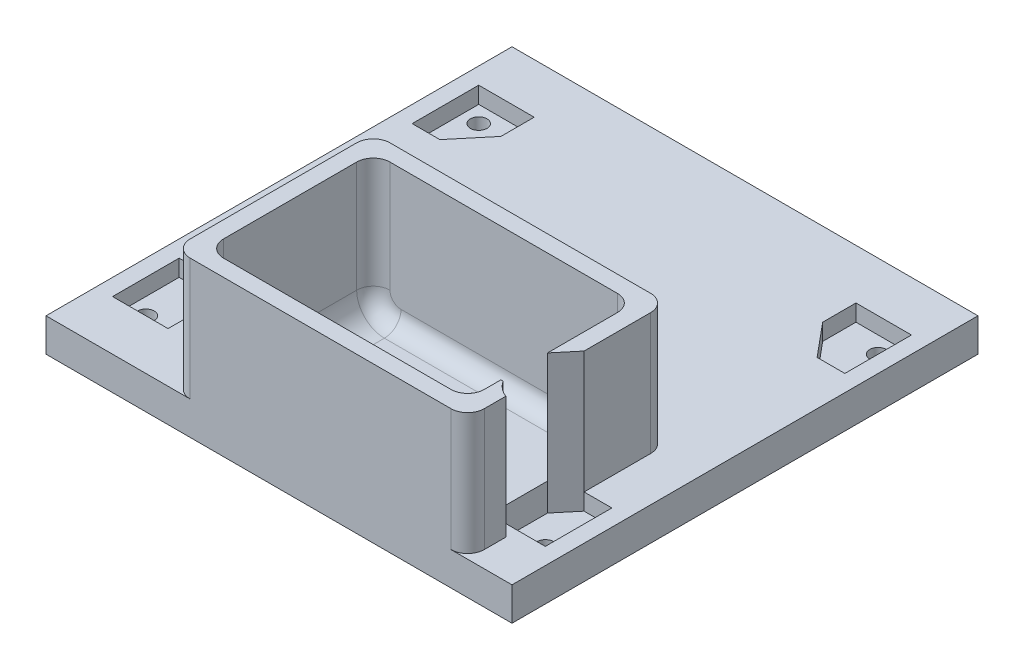
from build123d import *

# Parameters (mm, degrees)
SKETCH1_W               = 84
SKETCH1_H               = 84
BOSS_EXTRUDE1_DEPTH     = 6
SKETCH2_R               = 1.5
CUT_EXTRUDE1_DEPTH      = 119.94536561
SKETCH4_R               = 1.5
CUT_EXTRUDE4_DEPTH      = 3
MIRROR3_COPY_1_SKETCH_R = 1.5
MIRROR3_COPY_1_DEPTH    = 3
SKETCH5_W               = 53
SKETCH5_H               = 36
BOSS_EXTRUDE2_DEPTH     = 22
SKETCH6_W               = 47
SKETCH6_H               = 30
CUT_EXTRUDE5_DEPTH      = 25
FILLET1_R               = 3
FILLET2_R               = 5
BOSS_EXTRUDE3_START     = -17.4
BOSS_EXTRUDE3_DEPTH     = 8.4
CUT_EXTRUDE14_START     = -22
CUT_EXTRUDE14_DEPTH     = 22
CUT_EXTRUDE15_DEPTH     = 122.396046085


# Read off the part's stored shape, not the designer's step: Boss-Extrude3
with BuildPart() as part:
    # Sketch1 → Boss-Extrude1 (new body)
    with BuildSketch(Plane(origin=(0, 0, 0), x_dir=(1, 0, 0), z_dir=(0, 1, 0))):
        with Locations((42, 42)):
            Rectangle(SKETCH1_W, SKETCH1_H)
    extrude(amount=BOSS_EXTRUDE1_DEPTH)

    # Sketch2 → Cut-Extrude1 (cut, through all)
    with BuildSketch(Plane(origin=(0, 6, 0), x_dir=(1, 0, 0), z_dir=(0, 1, 0))):
        with Locations(Location((6, 72, 0), (0, 0, 270))):
            Circle(SKETCH2_R)
        with Locations(Location((6, 12, 0), (0, 0, 270))):
            Circle(SKETCH2_R)
        with Locations(Location((78, 12, 0), (0, 0, 270))):
            Circle(SKETCH2_R)
        with Locations(Location((78, 72, 0), (0, 0, 270))):
            Circle(SKETCH2_R)
    extrude(amount=-CUT_EXTRUDE1_DEPTH, mode=Mode.SUBTRACT)

    # Sketch4 → Cut-Extrude4 (cut)
    with BuildSketch(Plane(origin=(0, 6, 0), x_dir=(1, 0, 0), z_dir=(0, 1, 0))):
        Polygon((13, 15), (13, 9), (3, 9), (3, 21), (8, 21), align=None)
        with Locations(Location((6, 12, 0), (0, 0, 270))):
            Circle(SKETCH4_R, mode=Mode.SUBTRACT)
    cut_extrude4 = extrude(amount=-CUT_EXTRUDE4_DEPTH, mode=Mode.SUBTRACT)

    # Mirror2: Cut-Extrude4 across plane
    add(cut_extrude4.mirror(Plane.XY.offset(-42)), mode=Mode.SUBTRACT)

    # Mirror3: Cut-Extrude4 across plane
    add(cut_extrude4.mirror(Plane.ZY.offset(-42)), mode=Mode.SUBTRACT)

    # Mirror3 copy 1 sketch → Mirror3 copy 1 (cut)
    with BuildSketch(Plane(origin=(84, 6, -84), x_dir=(-1, 0, 0), z_dir=(0, 1, 0))):
        Polygon((13, 15), (13, 9), (3, 9), (3, 21), (8, 21), align=None)
        with Locations(Location((6, 12, 0), (0, 0, 270))):
            Circle(MIRROR3_COPY_1_SKETCH_R, mode=Mode.SUBTRACT)
    extrude(amount=-MIRROR3_COPY_1_DEPTH, mode=Mode.SUBTRACT)

    # Sketch5 → Boss-Extrude2 (add)
    with BuildSketch(Plane(origin=(0, 6, 0), x_dir=(1, 0, 0), z_dir=(0, 1, 0))):
        with Locations((49.5, 18)):
            Rectangle(SKETCH5_W, SKETCH5_H)
    extrude(amount=BOSS_EXTRUDE2_DEPTH)

    # Sketch6 → Cut-Extrude5 (cut)
    with BuildSketch(Plane(origin=(0, 28, 0), x_dir=(1, 0, 0), z_dir=(0, 1, 0))):
        with Locations((49.5, 18)):
            Rectangle(SKETCH6_W, SKETCH6_H)
    extrude(amount=-CUT_EXTRUDE5_DEPTH, mode=Mode.SUBTRACT)

    # Fillet1
    fillet1_edges = [part.edges().sort_by_distance(p)[0] for p in [
        (76, 17, -36),
        (23, 17, -36),
        (23, 17, 0),
        (76, 17, 0),
        (73, 15.5, -33),
        (49.5, 3, -3),
        (73, 15.5, -3),
        (26, 15.5, -3),
        (49.5, 3, -33),
        (26, 15.5, -33),
    ]]
    fillet(fillet1_edges, radius=FILLET1_R)

    # Fillet2
    # the kernel refuses this fillet: 5 mm, written as the material it adds along each edge
    with BuildSketch(Plane(origin=(31, 8, -3), x_dir=(-1, 0, 0), z_dir=(0, 1, 0))) as fillet2_piece_1:
        with BuildLine():
            CenterArc((2, -3), 3, 0, 90)
            Line((5, -3), (5, 0))
            Line((5, 0), (2, 0))
        make_face()
    revolve(axis=Axis((31, 8, -3), (0, 0, 1)), revolution_arc=90)
    with BuildSketch(Plane(origin=(31, 8, -33), x_dir=(0, -1, 0), z_dir=(1, 0, 0))) as fillet2_piece_2:
        with BuildLine():
            CenterArc((2, -3), 3, 0, 90)
            Line((5, -3), (5, 0))
            Line((5, 0), (2, 0))
        make_face()
    revolve(axis=Axis((31, 8, -33), (0, 0, -1)), revolution_arc=90)
    with BuildSketch(Plane(origin=(68, 8, -3), x_dir=(0, -1, 0), z_dir=(-1, 0, 0))) as fillet2_piece_3:
        with BuildLine():
            CenterArc((2, -3), 3, 0, 90)
            Line((5, -3), (5, 0))
            Line((5, 0), (2, 0))
        make_face()
    revolve(axis=Axis((68, 8, -3), (0, 0, 1)), revolution_arc=90)
    with BuildSketch(Plane(origin=(73, 3, -4.9), x_dir=(-1, 0, 0), z_dir=(0, 0, -1))) as fillet2_piece_4_section:
        with BuildLine():
            CenterArc((FILLET2_R, FILLET2_R), FILLET2_R, 180, 90)
            Line((0, FILLET2_R), (0, 0))
            Line((0, 0), (FILLET2_R, 0))
        make_face()
    fillet2_piece_4 = extrude(amount=37.6, mode=Mode.PRIVATE)
    fillet2_piece_4 = split(fillet2_piece_4, bisect_by=Plane(origin=(71.840443932, 4.051726495, -9), z_dir=(0, 0, 1)), keep=Keep.TOP, mode=Mode.PRIVATE)
    add(fillet2_piece_4)
    with BuildSketch(Plane(origin=(73, 3, -4.9), x_dir=(-1, 0, 0), z_dir=(0, 0, -1))) as fillet2_piece_5_section:
        with BuildLine():
            CenterArc((FILLET2_R, FILLET2_R), FILLET2_R, 180, 90)
            Line((0, FILLET2_R), (0, 0))
            Line((0, 0), (FILLET2_R, 0))
        make_face()
    fillet2_piece_5 = extrude(amount=37.6, mode=Mode.PRIVATE)
    fillet2_piece_5 = split(fillet2_piece_5, bisect_by=Plane(origin=(72.877053979, 6.49875804, -36), z_dir=(0, 0, 1)), keep=Keep.TOP, mode=Mode.PRIVATE)
    fillet2_piece_5 = split(fillet2_piece_5, bisect_by=Plane(origin=(72.877053979, 6, -13.126232387), z_dir=(0, 1, 0)), keep=Keep.TOP, mode=Mode.PRIVATE)
    add(fillet2_piece_5)
    with BuildSketch(Plane(origin=(73, 3, -4.9), x_dir=(-1, 0, 0), z_dir=(0, 0, -1))) as fillet2_piece_6_section:
        with BuildLine():
            CenterArc((FILLET2_R, FILLET2_R), FILLET2_R, 180, 90)
            Line((0, FILLET2_R), (0, 0))
            Line((0, 0), (FILLET2_R, 0))
        make_face()
    fillet2_piece_6 = extrude(amount=37.6, mode=Mode.PRIVATE)
    fillet2_piece_6 = split(fillet2_piece_6, bisect_by=Plane(origin=(74.593810092, 3.935909556, -19.312572111), z_dir=(-0.7682212795973755, 0, -0.6401843996644804)), keep=Keep.TOP, mode=Mode.PRIVATE)
    fillet2_piece_6 = split(fillet2_piece_6, bisect_by=Plane(origin=(71.754876355, 6, -21.678350226), z_dir=(0, -1, 0)), keep=Keep.TOP, mode=Mode.PRIVATE)
    add(fillet2_piece_6)
    with BuildSketch(Plane(origin=(73, 3, -3), x_dir=(-1, 0, 0), z_dir=(0, 0, -1))) as fillet2_piece_7:
        with BuildLine():
            CenterArc((FILLET2_R, FILLET2_R), FILLET2_R, 180, 90)
            Line((0, FILLET2_R), (0, 0))
            Line((0, 0), (FILLET2_R, 0))
        make_face()
    extrude(amount=6)
    with BuildSketch(Plane(origin=(73, 3, -3), x_dir=(-1, 0, 0), z_dir=(0, 0, -1))) as fillet2_piece_8_section:
        with BuildLine():
            CenterArc((FILLET2_R, FILLET2_R), FILLET2_R, 180, 90)
            Line((0, FILLET2_R), (0, 0))
            Line((0, 0), (FILLET2_R, 0))
        make_face()
    fillet2_piece_8 = extrude(amount=18.5, mode=Mode.PRIVATE)
    fillet2_piece_8 = split(fillet2_piece_8, bisect_by=Plane(origin=(72.877053979, 6, -13.126232386), z_dir=(0, 1, 0)), keep=Keep.TOP, mode=Mode.PRIVATE)
    add(fillet2_piece_8)
    with BuildSketch(Plane(origin=(73, 3, -3), x_dir=(-1, 0, 0), z_dir=(0, 0, -1))) as fillet2_piece_9_section:
        with BuildLine():
            CenterArc((FILLET2_R, FILLET2_R), FILLET2_R, 180, 90)
            Line((0, FILLET2_R), (0, 0))
            Line((0, 0), (FILLET2_R, 0))
        make_face()
    fillet2_piece_9 = extrude(amount=18.5, mode=Mode.PRIVATE)
    fillet2_piece_9 = split(fillet2_piece_9, bisect_by=Plane(origin=(73.049643728, 3.899661729, -17.459572473), z_dir=(-0.7682212795973755, 0, -0.6401843996644804)), keep=Keep.TOP, mode=Mode.PRIVATE)
    add(fillet2_piece_9)
    with BuildSketch(Plane(origin=(26, 3, -33), x_dir=(1, 0, 0), z_dir=(0, 0, 1))) as fillet2_piece_10:
        with BuildLine():
            CenterArc((FILLET2_R, FILLET2_R), FILLET2_R, 180, 90)
            Line((0, FILLET2_R), (0, 0))
            Line((0, 0), (FILLET2_R, 0))
        make_face()
    extrude(amount=30)

    # Boss-Extrude3 outline → Boss-Extrude3 (add)
    with BuildSketch(Plane.XY.offset(BOSS_EXTRUDE3_START)):
        with BuildLine():
            Line((73, 6), (72.582575695, 6))
            ThreePointArc((72.582575695, 6), (70.738612788, 3.816699867), (68, 3))
            Line((68, 3), (73, 3))
            Line((73, 3), (73, 6))
        make_face()
    extrude(amount=BOSS_EXTRUDE3_DEPTH)

    # Sketch8 → Cut-Extrude14 (cut)
    with BuildSketch(Plane(origin=(0, 28, 0), x_dir=(1, 0, 0), z_dir=(0, 1, 0)).offset(CUT_EXTRUDE14_START)):
        with BuildLine():
            Line((76, 9), (76, 17.123475383))
            ThreePointArc((76, 17.123475383), (74.22437799, 15.99933475), (73, 14.291287847))
            Line((73, 14.291287847), (73, 9.708712153))
            ThreePointArc((73, 9.708712153), (73.182064882, 9.347171095), (73.390227771, 9))
            Line((73.390227771, 9), (76, 9))
        make_face()
        with BuildLine():
            Line((76, 6.876524617), (76, 9))
            Line((76, 9), (73.390227771, 9))
            ThreePointArc((73.390227771, 9), (74.528752508, 7.733802531), (76, 6.876524617))
        make_face()
    extrude(amount=CUT_EXTRUDE14_DEPTH, mode=Mode.SUBTRACT)

    # Sketch13 → Cut-Extrude15 (cut, through all)
    with BuildSketch(Plane(origin=(0, 3, 0), x_dir=(1, 0, 0), z_dir=(0, 1, 0))):
        Polygon((73, 17.4), (73, 9), (81, 9), (81, 21), (76, 21), align=None)
    extrude(amount=CUT_EXTRUDE15_DEPTH, mode=Mode.SUBTRACT)


solid = part.part
